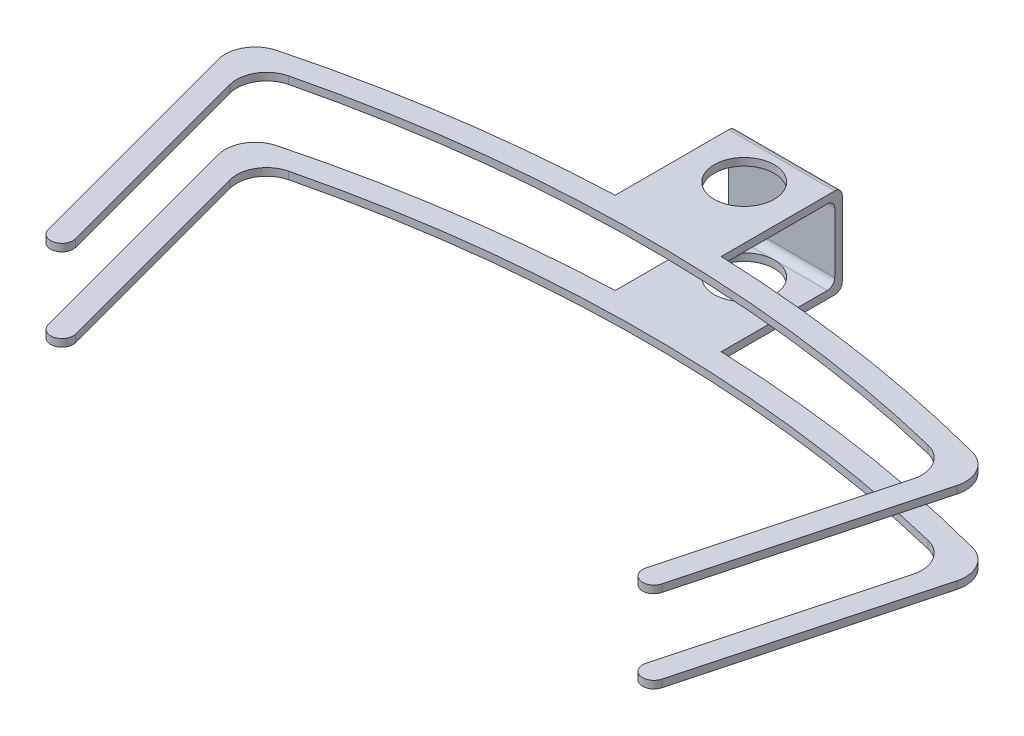
from build123d import *

# Parameters (mm, degrees)
BOSS_EXTRUDE1_DEPTH   = 0.5
FILLET3_R             = 2
FILLET4_R             = 0.75
FILLET5_R             = 0.75
SKETCH2_W             = 0.5
SKETCH2_H             = 3
BOSS_EXTRUDE2_DEPTH   = 7.070737889
FILLET3_OF_MIRROR5_R  = 2
FILLET4_OF_MIRROR5_R  = 0.75
FILLET5_OF_MIRROR5_R  = 0.75
FILLET7_R             = 0.5
F_4_0MM_DOWEL_HOLE1_D = 4


with BuildPart() as part:
    # Sketch1 → Boss-Extrude1 (new body)
    with BuildSketch(Plane(origin=(0, 0, 0), x_dir=(1, 0, 0), z_dir=(0, 1, 0))):
        with BuildLine():
            Line((23.293714059, 86.933324366), (18.816144579, 70.222807571))
            Line((18.816144579, 70.222807571), (20.261027783, 69.819630142))
            Line((20.261027783, 69.819630142), (25.127648951, 87.982107603))
            ThreePointArc((25.127648951, 87.982107603), (14.434923875, 90.354208384), (3.535368944, 91.431674853))
            Line((3.535368944, 91.431674853), (3.535368944, 99))
            Line((3.535368944, 99), (-3.535368944, 99))
            Line((-3.535368944, 99), (-3.535368944, 91.431674853))
            ThreePointArc((-3.535368944, 91.431674853), (-14.434923875, 90.354208384), (-25.127648951, 87.982107603))
            Line((-25.127648951, 87.982107603), (-20.261027783, 69.819630142))
            Line((-20.261027783, 69.819630142), (-18.816144579, 70.222807571))
            Line((-18.816144579, 70.222807571), (-23.293714059, 86.933324366))
            ThreePointArc((-23.293714059, 86.933324366), (0, 90), (23.293714059, 86.933324366))
        make_face()
    boss_extrude1 = extrude(amount=BOSS_EXTRUDE1_DEPTH)

    # Fillet3
    fillet3_edges = [part.edges().sort_by_distance(p)[0] for p in [
        (-23.293714059, 0.25, -86.933324366),
        (-25.127648951, 0.25, -87.982107603),
        (25.127648951, 0.25, -87.982107603),
        (23.293714059, 0.25, -86.933324366),
    ]]
    fillet(fillet3_edges, radius=FILLET3_R)

    # Fillet4
    fillet4_edges = [part.edges().sort_by_distance(p)[0] for p in [
        (-18.816144579, 0.25, -70.222807571),
        (-20.261027783, 0.25, -69.819630142),
    ]]
    fillet(fillet4_edges, radius=FILLET4_R - 0.0001)  # a hair under: the kernel refuses the full size

    # Fillet5
    fillet5_edges = [part.edges().sort_by_distance(p)[0] for p in [
        (20.261027783, 0.25, -69.819630142),
        (18.816144579, 0.25, -70.222807571),
    ]]
    fillet(fillet5_edges, radius=FILLET5_R - 0.0001)  # a hair under: the kernel refuses the full size

    # Sketch2 → Boss-Extrude2 (add)
    with BuildSketch(Plane(origin=(3.535368944, 0, 0), x_dir=(0, 0, -1), z_dir=(1, 0, 0))):
        with Locations((99.25, 1.5)):
            Rectangle(SKETCH2_W, SKETCH2_H)
    boss_extrude2 = extrude(amount=-BOSS_EXTRUDE2_DEPTH)

    # Mirror3: Boss-Extrude2 across plane
    add(boss_extrude2.mirror(Plane.ZX.offset(3)))

    # Mirror5: Boss-Extrude1 across plane
    add(boss_extrude1.mirror(Plane.ZX.offset(3)))

    # Fillet3 of Mirror5
    fillet3_of_mirror5_edges = [part.edges().sort_by_distance(p)[0] for p in [
        (-23.293714059, 5.75, -86.933324366),
        (-25.127648951, 5.75, -87.982107603),
        (25.127648951, 5.75, -87.982107603),
        (23.293714059, 5.75, -86.933324366),
    ]]
    fillet(fillet3_of_mirror5_edges, radius=FILLET3_OF_MIRROR5_R)

    # Fillet4 of Mirror5
    fillet4_of_mirror5_edges = [part.edges().sort_by_distance(p)[0] for p in [
        (-18.816144579, 5.75, -70.222807571),
        (-20.261027783, 5.75, -69.819630142),
    ]]
    fillet(fillet4_of_mirror5_edges, radius=FILLET4_OF_MIRROR5_R - 0.0001)  # a hair under: the kernel refuses the full size

    # Fillet5 of Mirror5
    fillet5_of_mirror5_edges = [part.edges().sort_by_distance(p)[0] for p in [
        (20.261027783, 5.75, -69.819630142),
        (18.816144579, 5.75, -70.222807571),
    ]]
    fillet(fillet5_of_mirror5_edges, radius=FILLET5_OF_MIRROR5_R - 0.0001)  # a hair under: the kernel refuses the full size

    # Fillet7
    fillet7_edges = [part.edges().sort_by_distance(p)[0] for p in [
        (0, 5.5, -99),
        (0, 0.5, -99),
        (0, 0, -99.5),
        (0, 6, -99.5),
    ]]
    fillet(fillet7_edges, radius=FILLET7_R)

    # Ø4.0mm Dowel Hole1 (through all)
    with Locations(Plane(origin=(0, 6, 0), x_dir=(1, 0, 0), z_dir=(0, 1, 0))):
        with Locations((0, 96.5)):
            Hole(F_4_0MM_DOWEL_HOLE1_D / 2)


solid = part.part
